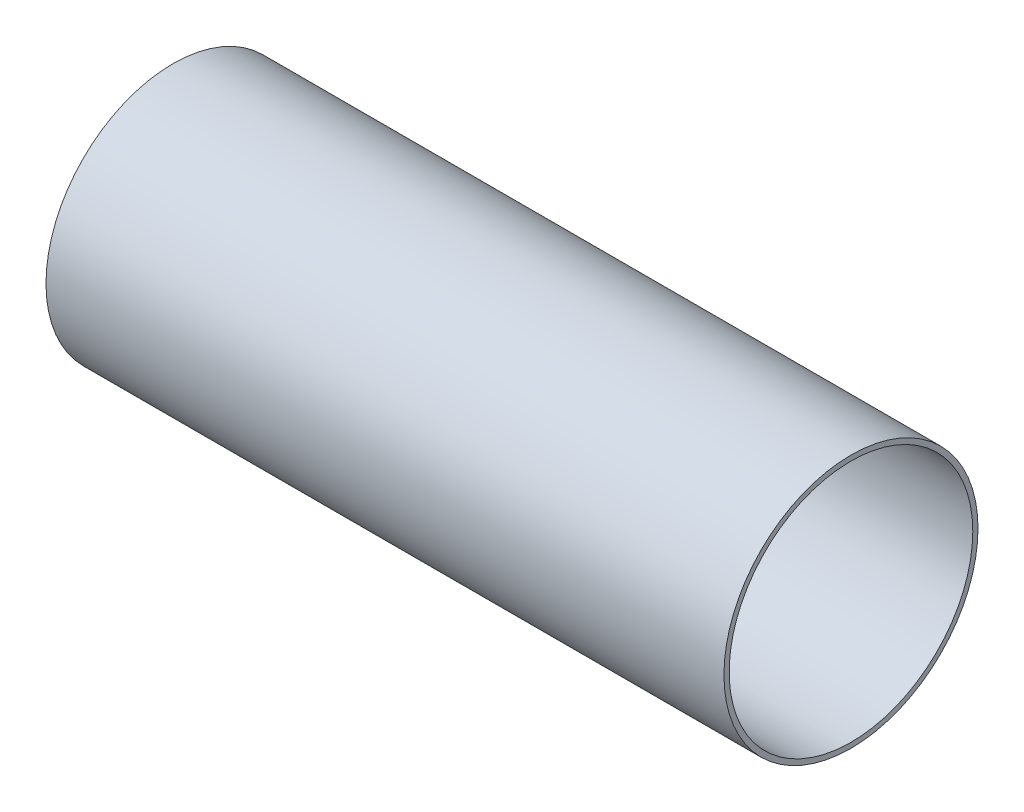
from build123d import *

# Parameters (mm, degrees)
SKETCH1_R           = 38.0746
SKETCH1_R_2         = 36.5125
BOSS_EXTRUDE1_DEPTH = 203.2


with BuildPart() as part:
    # Sketch1 → Boss-Extrude1 (new body)
    with BuildSketch(Plane.YZ):
        Circle(SKETCH1_R)
        Circle(SKETCH1_R_2, mode=Mode.SUBTRACT)
    extrude(amount=BOSS_EXTRUDE1_DEPTH)


solid = part.part
